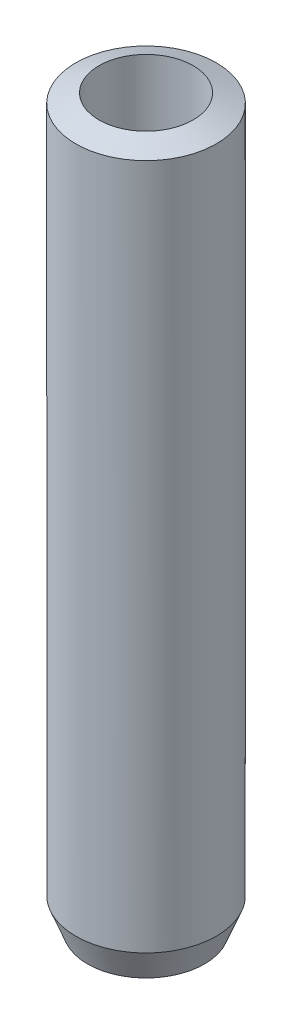
from build123d import *

# Parameters (mm, degrees)
SKETCH1_R           = 20
BOSS_EXTRUDE1_DEPTH = 207.198025
SKETCH2_R           = 13.399724126
CUT_EXTRUDE1_DEPTH  = 210.119634573
CHAMFER1_SIZE       = 3.349594
CHAMFER1_SIZE_2     = 8.537032


with BuildPart() as part:
    # Sketch1 → Boss-Extrude1 (new body)
    with BuildSketch(Plane(origin=(0, 0, 0), x_dir=(1, 0, 0), z_dir=(0, 1, 0))):
        with Locations(Location((0, 0, 0), (0, 0, 90))):
            Circle(SKETCH1_R)
    extrude(amount=BOSS_EXTRUDE1_DEPTH)

    # Sketch2 → Cut-Extrude1 (cut, through all)
    with BuildSketch(Plane(origin=(0, 0, 0), x_dir=(1, 0, 0), z_dir=(0, 1, 0))):
        with Locations(Location((0, 0, 0), (0, 0, 90))):
            Circle(SKETCH2_R)
    extrude(amount=CUT_EXTRUDE1_DEPTH, mode=Mode.SUBTRACT)

    # Chamfer1
    # the kernel refuses this chamfer: 8.537032, 3.349594 mm, written as the material it takes off along each edge
    with BuildSketch(Plane(origin=(0, 207.198025, 0), x_dir=(0, 0, -1), z_dir=(1, 0, 0))) as chamfer1_piece_1:
        Polygon((20, -CHAMFER1_SIZE), (20 - CHAMFER1_SIZE_2, 0), (20, 0), align=None)
    revolve(axis=Axis((0, 207.198025, 0), (0, 1, 0)), mode=Mode.SUBTRACT)
    with BuildSketch(Plane(origin=(0, 0, 0), x_dir=(0, 0, -1), z_dir=(1, 0, 0))) as chamfer1_piece_2:
        Polygon((20, CHAMFER1_SIZE_2), (20 - CHAMFER1_SIZE, 0), (20, 0), align=None)
    revolve(axis=Axis((0, 0, 0), (0, 1, 0)), mode=Mode.SUBTRACT)


solid = part.part
